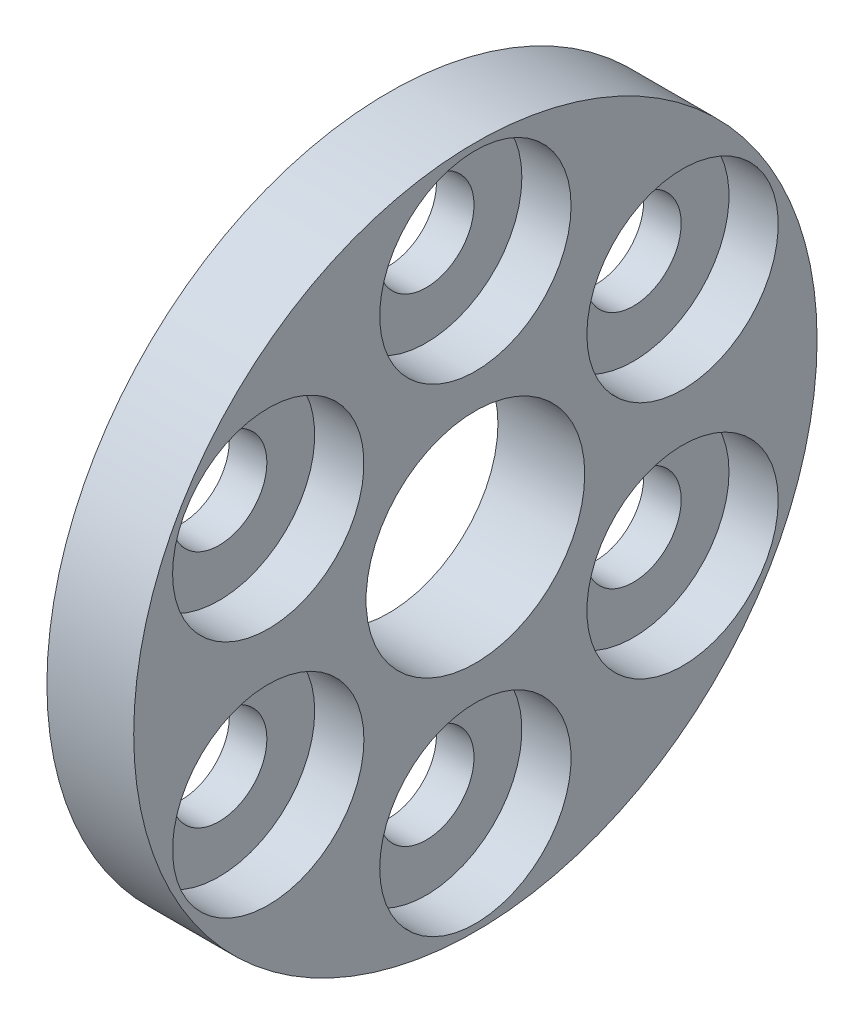
from build123d import *

# Parameters (mm, degrees)
SKETCH1_R           = 12.5
BOSS_EXTRUDE1_DEPTH = 3.175
SKETCH3_R           = 4
CUT_EXTRUDE1_DEPTH  = 18.960529641
SKETCH2_R           = 1.75
CUT_EXTRUDE2_DEPTH  = 18.960529641
SKETCH4_R           = 3.5
CUT_EXTRUDE3_DEPTH  = 1.8
CIRPATTERN3_COUNT   = 6


with BuildPart() as part:
    # Sketch1 → Boss-Extrude1 (new body)
    with BuildSketch(Plane(origin=(0, 0, 0), x_dir=(0, 0, -1), z_dir=(1, 0, 0))):
        Circle(SKETCH1_R)
    extrude(amount=BOSS_EXTRUDE1_DEPTH)

    # Sketch3 → Cut-Extrude1 (cut, through all)
    with BuildSketch(Plane(origin=(3.175, 0, 0), x_dir=(0, 0, -1), z_dir=(1, 0, 0))):
        Circle(SKETCH3_R)
    extrude(amount=-CUT_EXTRUDE1_DEPTH, mode=Mode.SUBTRACT)

    # Sketch2 → Cut-Extrude2 (cut, through all)
    with BuildSketch(Plane(origin=(3.175, 0, 0), x_dir=(0, 0, -1), z_dir=(1, 0, 0))):
        with Locations((0, 8.75)):
            Circle(SKETCH2_R)
    cut_extrude2 = extrude(amount=-CUT_EXTRUDE2_DEPTH, mode=Mode.SUBTRACT)

    # Sketch4 → Cut-Extrude3 (cut)
    with BuildSketch(Plane(origin=(3.175, 0, 0), x_dir=(0, 0, -1), z_dir=(1, 0, 0))):
        with Locations((0, 8.75)):
            Circle(SKETCH4_R)
    cut_extrude3 = extrude(amount=-CUT_EXTRUDE3_DEPTH, mode=Mode.SUBTRACT)

    # CirPattern3: Cut-Extrude2, Cut-Extrude3 ×6 about axis
    cirpattern3_axis = Axis((0, 0, 0), (1, 0, 0))
    add([cut_extrude2.rotate(cirpattern3_axis, i * 360 / CIRPATTERN3_COUNT) for i in range(1, CIRPATTERN3_COUNT)], mode=Mode.SUBTRACT)
    add([cut_extrude3.rotate(cirpattern3_axis, i * 360 / CIRPATTERN3_COUNT) for i in range(1, CIRPATTERN3_COUNT)], mode=Mode.SUBTRACT)


solid = part.part
